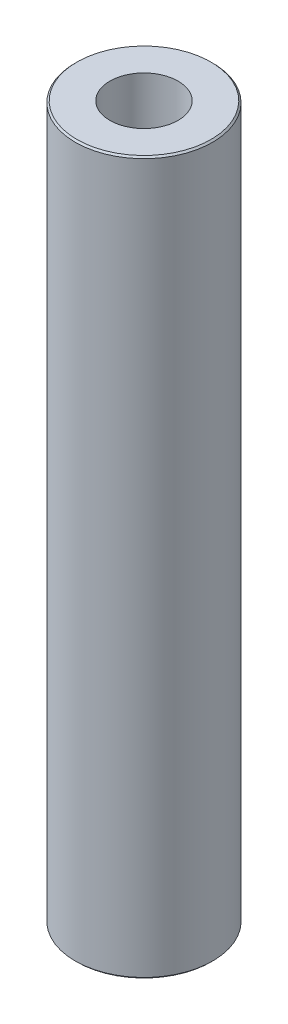
from build123d import *

# Parameters (mm, degrees)
SKETCH1_R           = 55
BOSS_EXTRUDE1_DEPTH = 570.362885615
SKETCH2_R           = 27.305828151
CUT_EXTRUDE1_DEPTH  = 576.642094784
CHAMFER1_SIZE       = 1.300889661


with BuildPart() as part:
    # Sketch1 → Boss-Extrude1 (new body)
    with BuildSketch(Plane(origin=(0, 0, 0), x_dir=(1, 0, 0), z_dir=(0, 1, 0))):
        Circle(SKETCH1_R)
    extrude(amount=BOSS_EXTRUDE1_DEPTH)

    # Sketch2 → Cut-Extrude1 (cut, through all)
    with BuildSketch(Plane(origin=(0, 0, 0), x_dir=(1, 0, 0), z_dir=(0, 1, 0))):
        Circle(SKETCH2_R)
    extrude(amount=CUT_EXTRUDE1_DEPTH, mode=Mode.SUBTRACT)

    # Chamfer1
    chamfer1_edges = [part.edges().sort_by_distance(p)[0] for p in [
        (-55, 570.362885615, 0),
        (-55, 0, 0),
    ]]
    chamfer(chamfer1_edges, length=CHAMFER1_SIZE)


solid = part.part
